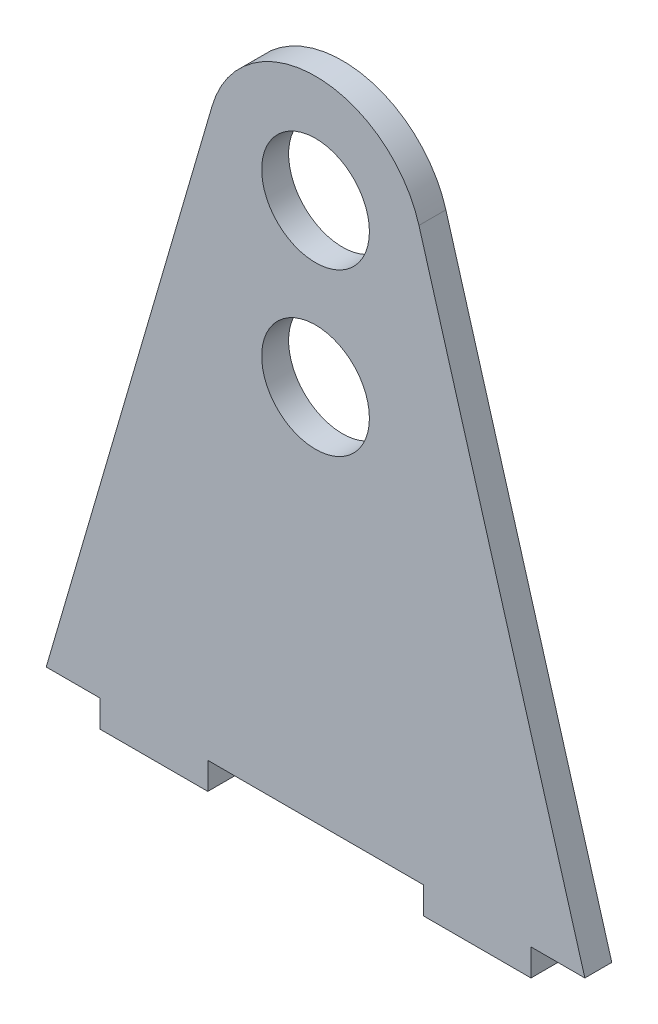
from build123d import *

# Parameters (mm, degrees)
SKETCH1_R           = 12.7
BOSS_EXTRUDE1_DEPTH = 6.35


with BuildPart() as part:
    # Sketch1 → Boss-Extrude1 (new body)
    with BuildSketch(Plane.XY):
        with BuildLine():
            Line((25.4, 0), (-25.4, 0))
            Line((-25.4, 0), (-25.4, -6.35))
            Line((-25.4, -6.35), (-50.8, -6.35))
            Line((-50.8, -6.35), (-50.8, 0))
            Line((-50.8, 0), (-63.5, 0))
            Line((-63.5, 0), (-24.384, 134.112))
            ThreePointArc((-24.384, 134.112), (0, 152.4), (24.384, 134.112))
            Line((24.384, 134.112), (63.5, 0))
            Line((63.5, 0), (50.8, 0))
            Line((50.8, 0), (50.8, -6.35))
            Line((50.8, -6.35), (25.4, -6.35))
            Line((25.4, -6.35), (25.4, 0))
        make_face()
        with Locations((0, 127)):
            Circle(SKETCH1_R, mode=Mode.SUBTRACT)
        with Locations((0, 88.9)):
            Circle(SKETCH1_R, mode=Mode.SUBTRACT)
    extrude(amount=BOSS_EXTRUDE1_DEPTH)


solid = part.part
